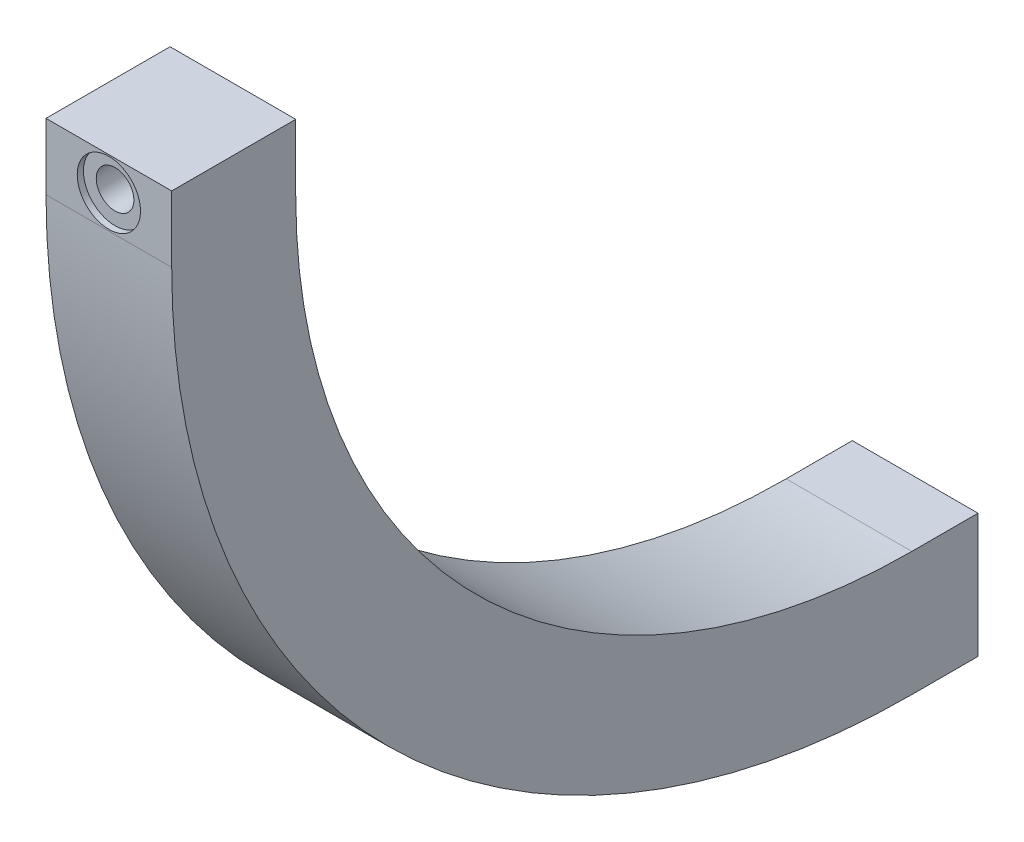
from build123d import *

# Parameters (mm, degrees)
BOSS_EXTRUDE1_DEPTH      = 7.6
BOSS_EXTRUDE1_DEPTH_BACK = 7.6
SKETCH7_R                = 1.75
CUT_EXTRUDE1_DEPTH       = 133.447197026
SKETCH12_R               = 2.275
CUT_EXTRUDE7_DEPTH       = 6
SKETCH14_R               = 3.825
CUT_EXTRUDE10_DEPTH      = 0.75
SKETCH15_R               = 1.5
CUT_EXTRUDE11_DEPTH      = 6


with BuildPart() as part:
    # Sketch5 → Boss-Extrude1 (new, two sides: drawn at the far end of the back side and taken through both)
    with BuildSketch(Plane(origin=(0, 0, 0), x_dir=(0, 0, -1), z_dir=(1, 0, 0)).offset(-BOSS_EXTRUDE1_DEPTH_BACK)):
        with BuildLine():
            Line((-78.5, 4), (-78.5, 0))
            Line((-78.5, 0), (-78.5, -4))
            ThreePointArc((-78.5, -4), (-56.679455198, -56.679455198), (-4, -78.5))
            Line((-4, -78.5), (0, -78.5))
            Line((0, -78.5), (4, -78.5))
            Line((4, -78.5), (4, -93.5))
            Line((4, -93.5), (-4, -93.5))
            ThreePointArc((-4, -93.5), (-67.286056916, -67.286056916), (-93.5, -4))
            Line((-93.5, -4), (-93.5, 4))
            Line((-93.5, 4), (-78.5, 4))
        make_face()
    extrude(amount=BOSS_EXTRUDE1_DEPTH + BOSS_EXTRUDE1_DEPTH_BACK)

    # Sketch7 → Cut-Extrude1 (cut, through all)
    with BuildSketch(Plane.XY):
        Circle(SKETCH7_R)
    extrude(amount=CUT_EXTRUDE1_DEPTH, mode=Mode.SUBTRACT)

    # Sketch12 → Cut-Extrude7 (cut)
    with BuildSketch(Plane.XY.offset(93.5)):
        Circle(SKETCH12_R)
    extrude(amount=-CUT_EXTRUDE7_DEPTH, mode=Mode.SUBTRACT)

    # Sketch14 → Cut-Extrude10 (cut)
    with BuildSketch(Plane(origin=(0, 0, 93.5), x_dir=(1, 0, 0), z_dir=(0, 0, -1))):
        Circle(SKETCH14_R)
    extrude(amount=CUT_EXTRUDE10_DEPTH, mode=Mode.SUBTRACT)

    # Sketch15 → Cut-Extrude11 (cut)
    with BuildSketch(Plane.XZ.offset(93.5)):
        Circle(SKETCH15_R)
    extrude(amount=-CUT_EXTRUDE11_DEPTH, mode=Mode.SUBTRACT)


solid = part.part
